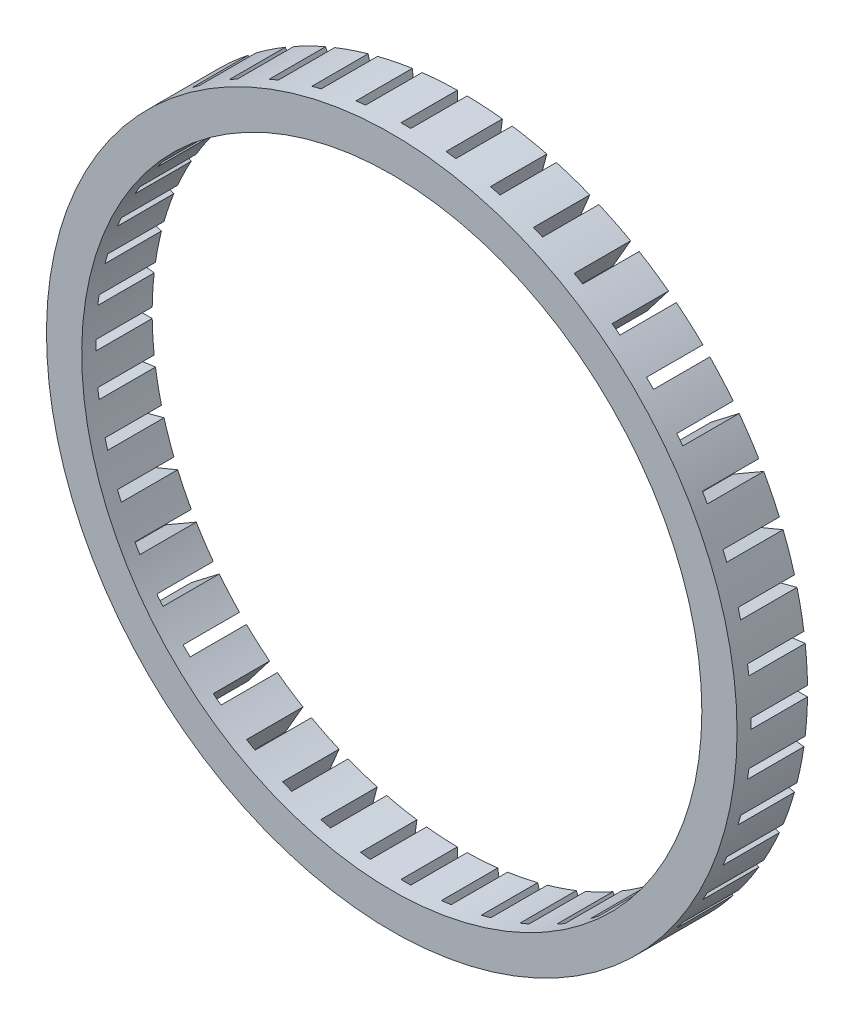
from build123d import *

# Parameters (mm, degrees)
SKETCH1_R           = 49
SKETCH1_R_2         = 44
BOSS_EXTRUDE1_DEPTH = 10
SKETCH3_W           = 1.4
SKETCH3_H           = 8
CUT_EXTRUDE1_DEPTH  = 71.014284257
CIRPATTERN1_COUNT   = 48


with BuildPart() as part:
    # Sketch1 → Boss-Extrude1 (new body)
    with BuildSketch(Plane.XY):
        Circle(SKETCH1_R)
        Circle(SKETCH1_R_2, mode=Mode.SUBTRACT)
    extrude(amount=BOSS_EXTRUDE1_DEPTH)

    # Sketch3 → Cut-Extrude1 (cut, symmetric)
    with BuildSketch(Plane(origin=(0, 0, 0), x_dir=(1, 0, 0), z_dir=(0, 1, 0))):
        with Locations((0, -4)):
            Rectangle(SKETCH3_W, SKETCH3_H)
    cut_extrude1 = extrude(amount=CUT_EXTRUDE1_DEPTH, both=True, mode=Mode.SUBTRACT)

    # CirPattern1: Cut-Extrude1 ×48 about axis
    cirpattern1_axis = Axis((0, 0, -0.5), (0, 0, 1))
    for i in range(1, CIRPATTERN1_COUNT):
        add(cut_extrude1.rotate(cirpattern1_axis, i * 360 / CIRPATTERN1_COUNT), mode=Mode.SUBTRACT)


solid = part.part
